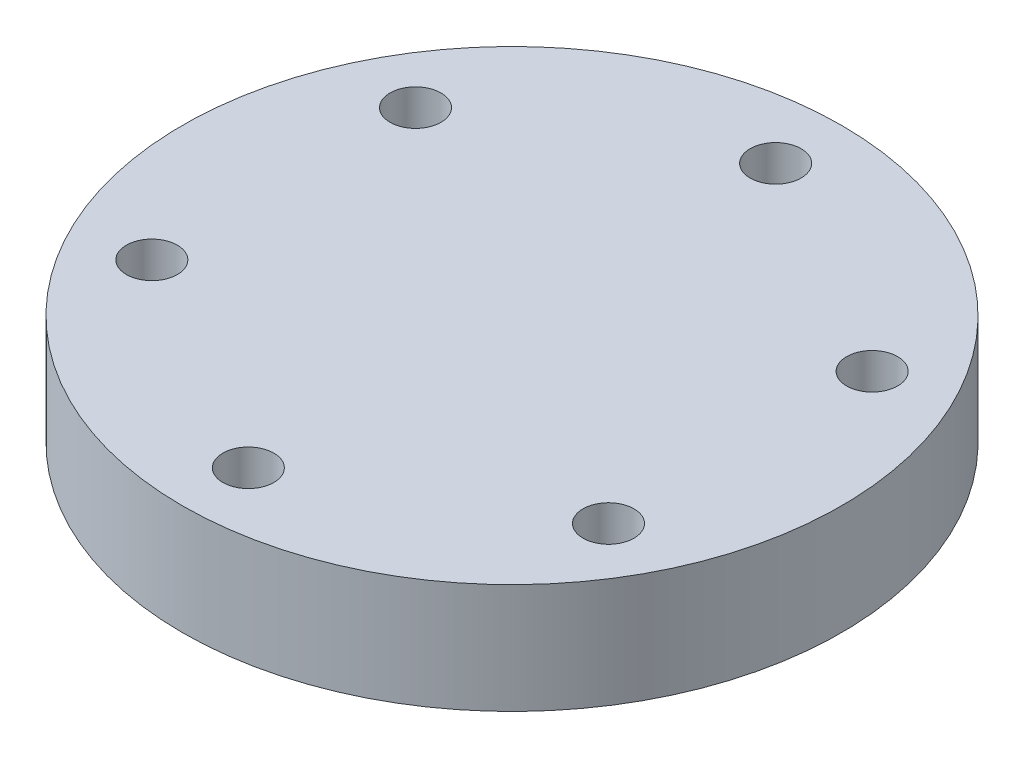
from build123d import *

# Parameters (mm, degrees)
OUTER_R                     = 19.05
BODY_DEPTH                  = 6.35
INNER_R                     = 11.6205
POCKET_DEPTH                = 3.81
F_32_0_116_DIAMETER_HOLE1_D = 2.9464
SCREW_HOLES_COUNT           = 6


with BuildPart() as part:
    # outer → Body (new body)
    with BuildSketch(Plane(origin=(0, 0, 0), x_dir=(1, 0, 0), z_dir=(0, 1, 0))):
        Circle(OUTER_R)
    extrude(amount=BODY_DEPTH)

    # inner → Pocket (cut)
    with BuildSketch(Plane(origin=(0, 0, 0), x_dir=(1, 0, 0), z_dir=(0, 1, 0))):
        Circle(INNER_R)
    extrude(amount=POCKET_DEPTH, mode=Mode.SUBTRACT)

    # #32 (0.116) Diameter Hole1 (through all)
    with Locations(Plane(origin=(0, 6.35, 0), x_dir=(1, 0, 0), z_dir=(0, 1, 0))):
        with Locations((0, 15.24)):
            f_32_0_116_diameter_hole1 = Hole(F_32_0_116_DIAMETER_HOLE1_D / 2)

    # Screw Holes: #32 (0.116) Diameter Hole1 ×6 about axis
    screw_holes_axis = Axis((0, 6.6675, 0), (0, -1, 0))
    for i in range(1, SCREW_HOLES_COUNT):
        add(f_32_0_116_diameter_hole1.rotate(screw_holes_axis, i * 360 / SCREW_HOLES_COUNT), mode=Mode.SUBTRACT)


solid = part.part
